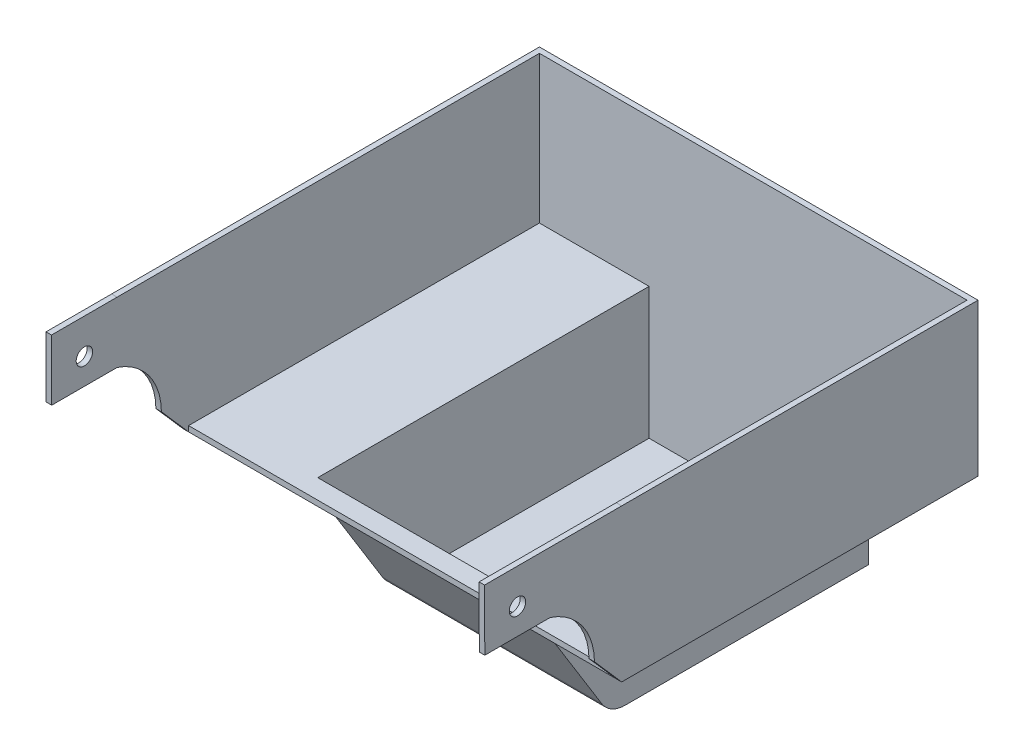
from build123d import *

# Parameters (mm, degrees)
EXTRUDE_1_DEPTH          = 124
SKETCH_2_W               = 160
SKETCH_2_H               = 55.63
EXTRUDE_2_DEPTH          = 6
CUT_EXTRUDE_1_DEPTH      = 186.458073159
CUT_EXTRUDE_1_DEPTH_BACK = 186.458073159
SHELL_START              = -78
SHELL_1_OUTLINE_W        = 53.63
SHELL_1_OUTLINE_H        = 126
SHELL_1_DEPTH            = 156
SHELL_START_2            = -38
SHELL_1_2_DEPTH          = 76
SKETCH_6_W               = 156
SKETCH_6_H               = 53.63
CUT_EXTRUDE_2_DEPTH      = 3
EXTRUDE_3_DEPTH          = 2
SKETCH_8_R               = 23.405642618
CUT_EXTRUDE_3_DEPTH      = 231.346358066
EXTRUDE_4_DEPTH          = 2
EXTRUDE_START            = -2
EXTRUDE_5_DEPTH          = 2
SKETCH_11_R              = 3
CUT_EXTRUDE_4_DEPTH      = 248.192749183


# Read off the part's stored shape, not the designer's step: 抽壳1
with BuildPart() as part:
    # 草图1 → 凸台-拉伸1 (new body)
    with BuildSketch(Plane.XY):
        Polygon((-80, 0), (-40, 0), (-40, -48), (40, -48), (40, 0), (80, 0), (80, 55.63), (-80, 55.63), align=None)
    extrude(amount=EXTRUDE_1_DEPTH)

    # 草图2 → 凸台-拉伸2 (add)
    with BuildSketch(Plane.XY.offset(124)):
        with Locations((0, 27.815)):
            Rectangle(SKETCH_2_W, SKETCH_2_H)
    extrude(amount=EXTRUDE_2_DEPTH)

    # 草图4 → 切除-拉伸1 (cut, two sides: drawn at the far end of the back side and taken through both)
    with BuildSketch(Plane.ZY.offset(40).offset(-CUT_EXTRUDE_1_DEPTH_BACK)):
        with BuildLine():
            Line((124, 0), (97.256578086, -43.258479388))
            ThreePointArc((97.256578086, -43.258479388), (93.619837537, -46.734551903), (88.750792142, -48))
            Line((88.750792142, -48), (88.750792142, -53.726448165))
            Line((88.750792142, -53.726448165), (126.100983763, -53.726448165))
            Line((126.100983763, -53.726448165), (126.100983763, 0))
            Line((126.100983763, 0), (124, 0))
        make_face()
    extrude(amount=CUT_EXTRUDE_1_DEPTH + CUT_EXTRUDE_1_DEPTH_BACK, mode=Mode.SUBTRACT)

    # 抽壳1 outline → 抽壳1 (cut)
    with BuildSketch(Plane.YZ.offset(SHELL_START)):
        with Locations((28.815, 65)):
            Rectangle(SHELL_1_OUTLINE_W, SHELL_1_OUTLINE_H)
    extrude(amount=SHELL_1_DEPTH, mode=Mode.SUBTRACT)

    # Shell 1 2 outline → Shell 1 2 (cut)
    with BuildSketch(Plane.YZ.offset(SHELL_START_2)):
        with BuildLine():
            Line((-46, 88.750792142), (-46, 2))
            Line((-46, 2), (2, 2))
            Line((2, 2), (2, 122.885106998))
            Line((2, 122.885106998), (-42.20678351, 95.555420897))
            ThreePointArc((-42.20678351, 95.555420897), (-44.987641522, 92.646028458), (-46, 88.750792142))
        make_face()
    extrude(amount=SHELL_1_2_DEPTH, mode=Mode.SUBTRACT)

    # 草图6 → 切除-拉伸2 (cut)
    with BuildSketch(Plane(origin=(0, 0, 128), x_dir=(-1, 0, 0), z_dir=(0, 0, -1))):
        with Locations((0, 28.815)):
            Rectangle(SKETCH_6_W, SKETCH_6_H)
    extrude(amount=-CUT_EXTRUDE_2_DEPTH, mode=Mode.SUBTRACT)

    # 草图7 → 凸台-拉伸3 (add)
    with BuildSketch(Plane.ZY.offset(80)):
        Polygon((130, 55.63), (156.092113107, 55.63), (156.092113107, 29.820089386), (130, 0), align=None)
    extrude(amount=-EXTRUDE_3_DEPTH)

    # 草图8 → 切除-拉伸3 (cut, through all)
    with BuildSketch(Plane.ZY.offset(80)):
        with Locations((163.334420687, 11.150000051)):
            Circle(SKETCH_8_R)
    extrude(amount=-CUT_EXTRUDE_3_DEPTH, mode=Mode.SUBTRACT)

    # 草图9 → 凸台-拉伸4 (add)
    with BuildSketch(Plane.ZY.offset(80)):
        Polygon((156.092113107, 33.406978446), (179.938761178, 33.406978446), (180.026549011, 55.62973882), (156.092113107, 55.63), align=None)
    extrude(amount=-EXTRUDE_4_DEPTH)

    # 草图10 → 凸台-拉伸5 (add)
    with BuildSketch(Plane(origin=(80, 0, 0), x_dir=(0, 0, -1), z_dir=(1, 0, 0)).offset(EXTRUDE_START)):
        with BuildLine():
            Line((-130, 55.63), (-180.026549011, 55.62973882))
            Line((-180.026549011, 55.62973882), (-179.938761178, 33.406978446))
            Line((-179.938761178, 33.406978446), (-156.092113107, 33.406978446))
            ThreePointArc((-156.092113107, 33.406978446), (-144.454345373, 24.983541264), (-139.929618433, 11.348337638))
            Line((-139.929618433, 11.348337638), (-130, 0))
            Line((-130, 0), (-130, 55.63))
        make_face()
    extrude(amount=EXTRUDE_5_DEPTH)

    # 草图11 → 切除-拉伸4 (cut, through all)
    with BuildSketch(Plane(origin=(80, 0, 0), x_dir=(0, 0, -1), z_dir=(1, 0, 0))):
        with Locations((-168.015437143, 42.878856115)):
            Circle(SKETCH_11_R)
    extrude(amount=-CUT_EXTRUDE_4_DEPTH, mode=Mode.SUBTRACT)


solid = part.part
